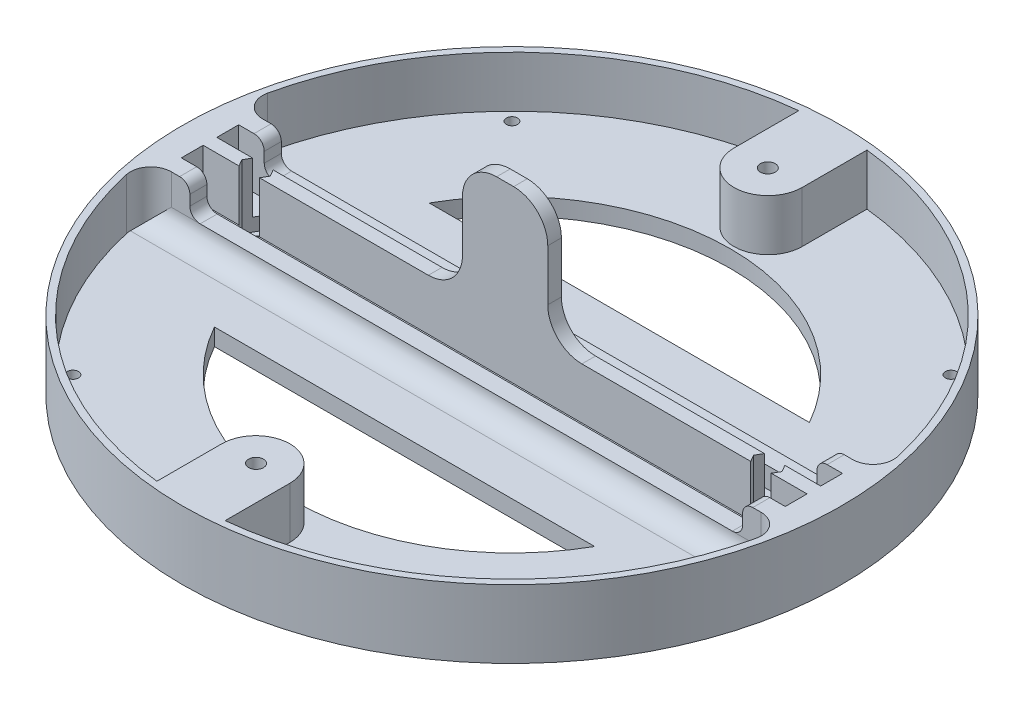
from build123d import *

# Parameters (mm, degrees)
SKETCH1_R           = 96.6
BOSS_EXTRUDE1_DEPTH = 5
SKETCH4_R           = 96.6
SKETCH4_R_2         = 94.6
BOSS_EXTRUDE3_DEPTH = 15
SKETCH5_W           = 189.2
SKETCH5_H           = 13.4
SKETCH5_W_2         = 177
SKETCH5_H_2         = 6.4
BOSS_EXTRUDE4_DEPTH = 15
SKETCH6_R           = 22.5
CUT_EXTRUDE1_DEPTH  = 4
CUT_EXTRUDE2_DEPTH  = 9
BOSS_EXTRUDE6_DEPTH = 15
SKETCH8_R           = 2.175
CUT_EXTRUDE4_DEPTH  = 29
CUT_EXTRUDE9_DEPTH  = 30
FILLET3_R           = 3
SKETCH20_R          = 1.65
CUT_EXTRUDE10_DEPTH = 10
SKETCH24_W          = 25
SKETCH24_H          = 4
BOSS_EXTRUDE8_DEPTH = 35
FILLET2_R           = 10
CUT_EXTRUDE11_DEPTH = 18.8
FILLET4_R           = 6


with BuildPart() as part:
    # Sketch1 → Boss-Extrude1 (new body)
    with BuildSketch(Plane(origin=(0, 0, 0), x_dir=(1, 0, 0), z_dir=(0, 1, 0))):
        with Locations(Location((0, 0, 0), (0, 0, 270))):
            Circle(SKETCH1_R)
    extrude(amount=BOSS_EXTRUDE1_DEPTH)

    # Sketch4 → Boss-Extrude3 (add)
    with BuildSketch(Plane(origin=(0, 5, 0), x_dir=(1, 0, 0), z_dir=(0, 1, 0))):
        with Locations(Location((0, 0, 0), (0, 0, 270))):
            Circle(SKETCH4_R)
        with Locations(Location((0, 0, 0), (0, 0, 270))):
            Circle(SKETCH4_R_2, mode=Mode.SUBTRACT)
    extrude(amount=BOSS_EXTRUDE3_DEPTH)

    # Sketch5 → Boss-Extrude4 (add)
    with BuildSketch(Plane(origin=(0, 5, 0), x_dir=(1, 0, 0), z_dir=(0, 1, 0))):
        with Locations((0, -6.7)):
            Rectangle(SKETCH5_W, SKETCH5_H)
        with Locations((0, -5.2)):
            Rectangle(SKETCH5_W_2, SKETCH5_H_2, mode=Mode.SUBTRACT)
    boss_extrude4 = extrude(amount=BOSS_EXTRUDE4_DEPTH)

    # Mirror1: Boss-Extrude4 across plane
    add(boss_extrude4.mirror(Plane.XY))

    # Sketch6 → Cut-Extrude1 (cut)
    with BuildSketch(Plane.XZ):
        with Locations(Location((0, 0, 0), (0, 0, 270))):
            Circle(SKETCH6_R)
    extrude(amount=-CUT_EXTRUDE1_DEPTH, mode=Mode.SUBTRACT)

    # Sketch7 → Cut-Extrude2 (cut)
    with BuildSketch(Plane(origin=(0, 20, 0), x_dir=(1, 0, 0), z_dir=(0, 1, 0))):
        Polygon((0, -13.4), (-81, -13.4), (-81, -8.4), (0, -8.4), (81, -8.4), (81, -13.4), align=None)
    cut_extrude2 = extrude(amount=-CUT_EXTRUDE2_DEPTH, mode=Mode.SUBTRACT)

    # Mirror2: Cut-Extrude2 across plane
    add(cut_extrude2.mirror(Plane.XY), mode=Mode.SUBTRACT)

    # Sketch10 → Boss-Extrude6 (add)
    with BuildSketch(Plane(origin=(0, 5, 0), x_dir=(1, 0, 0), z_dir=(0, 1, 0))):
        with BuildLine():
            Line((-10, -75.073785704), (-10, -95.073785704))
            Line((-10, -95.073785704), (10, -95.073785704))
            Line((10, -95.073785704), (10, -75.073785704))
            ThreePointArc((10, -75.073785704), (0, -65.073785704), (-10, -75.073785704))
        make_face()
    boss_extrude6 = extrude(amount=BOSS_EXTRUDE6_DEPTH)

    # Mirror3: Boss-Extrude6 across plane
    add(boss_extrude6.mirror(Plane.XY))

    # Sketch8 → Cut-Extrude4 (cut)
    with BuildSketch(Plane.XZ):
        with Locations(Location((-75, 0, 0), (0, 0, 270))):
            Circle(SKETCH8_R)
        with Locations(Location((0, 75, 0), (0, 0, 270))):
            Circle(SKETCH8_R)
        with Locations(Location((75, 0, 0), (0, 0, 270))):
            Circle(SKETCH8_R)
        with Locations(Location((0, -75, 0), (0, 0, 270))):
            Circle(SKETCH8_R)
    extrude(amount=-CUT_EXTRUDE4_DEPTH, mode=Mode.SUBTRACT)

    # Sketch19 → Cut-Extrude9 (cut)
    with BuildSketch(Plane(origin=(0, 5, 0), x_dir=(1, 0, 0), z_dir=(0, 1, 0))):
        with BuildLine():
            Line((-55.725373322, -31.475113472), (55.725373322, -31.475113472))
            ThreePointArc((55.725373322, -31.475113472), (0, -64), (-55.725373322, -31.475113472))
        make_face()
    cut_extrude9 = extrude(amount=-CUT_EXTRUDE9_DEPTH, mode=Mode.SUBTRACT)

    # Mirror4: Cut-Extrude9 across plane
    add(cut_extrude9.mirror(Plane.XY), mode=Mode.SUBTRACT)

    # Fillet3
    fillet3_edges = [part.edges().sort_by_distance(p)[0] for p in [
        (81, 20, -10.9),
        (-81, 20, -10.9),
        (81, 11, -10.9),
        (-81, 11, -10.9),
        (-81, 11, 10.9),
        (81, 11, 10.9),
        (81, 20, 10.9),
        (-81, 20, 10.9),
    ]]
    fillet(fillet3_edges, radius=FILLET3_R)

    # Sketch20 → Cut-Extrude10 (cut)
    with BuildSketch(Plane.XZ):
        with Locations(Location((-64.346717088, 64.346717088, 0), (0, 0, 270))):
            Circle(SKETCH20_R)
        with Locations(Location((64.346717088, 64.346717088, 0), (0, 0, 270))):
            Circle(SKETCH20_R)
        with Locations(Location((64.346717088, -64.346717088, 0), (0, 0, 270))):
            Circle(SKETCH20_R)
        with Locations(Location((-64.346717088, -64.346717088, 0), (0, 0, 270))):
            Circle(SKETCH20_R)
    extrude(amount=-CUT_EXTRUDE10_DEPTH, mode=Mode.SUBTRACT)

    # Sketch24 → Boss-Extrude8 (add)
    with BuildSketch(Plane(origin=(0, 20, 0), x_dir=(1, 0, 0), z_dir=(0, 1, 0))):
        Rectangle(SKETCH24_W, SKETCH24_H)
    extrude(amount=BOSS_EXTRUDE8_DEPTH)

    # Fillet2
    fillet2_edges = [part.edges().sort_by_distance(p)[0] for p in [
        (12.5, 20, 0),
        (-12.5, 20, 0),
        (12.5, 55, 0),
        (-12.5, 55, 0),
    ]]
    fillet(fillet2_edges, radius=FILLET2_R)

    # Sketch25 → Cut-Extrude11 (cut)
    with BuildSketch(Plane(origin=(0, 20, 0), x_dir=(1, 0, 0), z_dir=(0, 1, 0))):
        Polygon((70.843078062, 0), (72.921539031, -3.6), (77.078460969, -3.6), (79.156921938, 0), (77.078460969, 3.6), (72.921539031, 3.6), align=None)
        Polygon((-70.843078062, 0), (-72.921539031, 3.6), (-77.078460969, 3.6), (-79.156921938, 0), (-77.078460969, -3.6), (-72.921539031, -3.6), align=None)
    extrude(amount=-CUT_EXTRUDE11_DEPTH, mode=Mode.SUBTRACT)

    # Fillet4
    fillet4_edges = [part.edges().sort_by_distance(p)[0] for p in [
        (0, 5, 13.4),
        (93.646142473, 12.5, 13.4),
        (-93.646142473, 12.5, 13.4),
        (93.646142473, 12.5, -13.4),
        (-93.646142473, 12.5, -13.4),
        (0, 5, -13.4),
    ]]
    fillet(fillet4_edges, radius=FILLET4_R - 0.0001)  # a hair under: the kernel refuses the full size


solid = part.part
